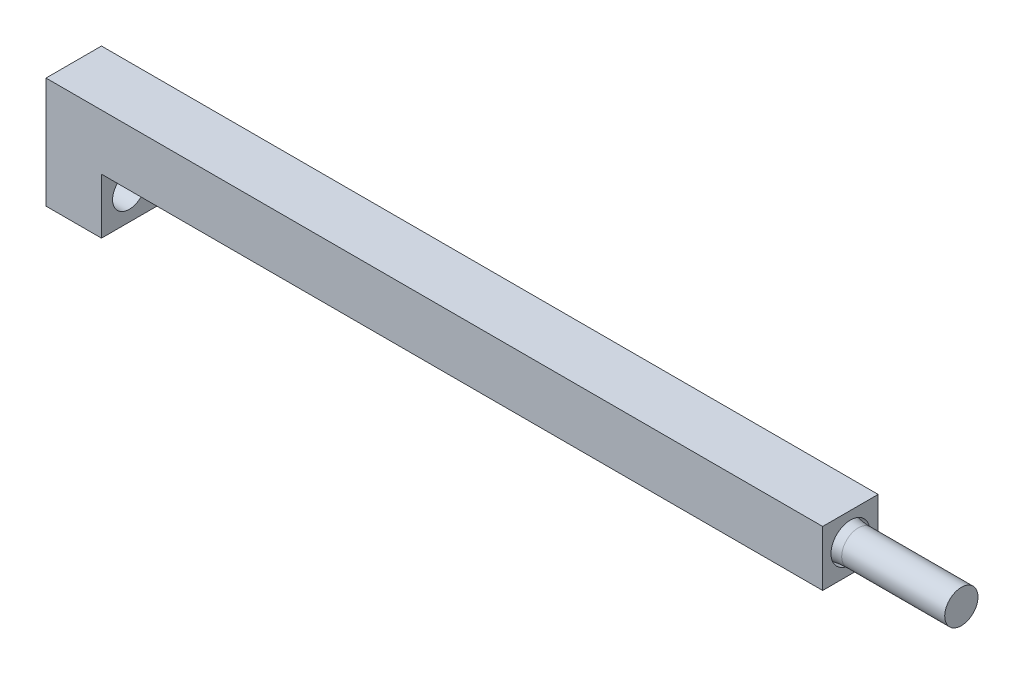
from build123d import *

# Parameters (mm, degrees)
BOSS_EXTRUDE1_DEPTH = 10
SKETCH4_R           = 3
CUT_EXTRUDE2_DEPTH  = 150
SKETCH4_5_R         = 3
BOSS_EXTRUDE3_DEPTH = 20
CUT_EXTRUDE4_START  = -2
SKETCH5_R           = 3.5
SKETCH5_R_2         = 3
CUT_EXTRUDE4_DEPTH  = 2
FILLET2_R           = 12


with BuildPart() as part:
    # Sketch1 → Boss-Extrude1 (new body)
    with BuildSketch(Plane.XY):
        Polygon((-140, 10), (0, 10), (0, 0), (-130, 0), (-130, -10), (-140, -10), align=None)
    extrude(amount=BOSS_EXTRUDE1_DEPTH)

    # Sketch4 → Cut-Extrude2 (cut)
    with BuildSketch(Plane(origin=(0, 0, 0), x_dir=(0, 0, -1), z_dir=(1, 0, 0))):
        with Locations(Location((-5, -5, 0), (0, 0, 90))):
            Circle(SKETCH4_R)
    extrude(amount=-CUT_EXTRUDE2_DEPTH, mode=Mode.SUBTRACT)

    # Sketch4<5> → Boss-Extrude3 (add)
    with BuildSketch(Plane(origin=(0, 0, 0), x_dir=(0, 0, -1), z_dir=(1, 0, 0))):
        with Locations((-5, 5)):
            Circle(SKETCH4_5_R)
    extrude(amount=BOSS_EXTRUDE3_DEPTH)

    # Sketch5 → Cut-Extrude4 (cut)
    with BuildSketch(Plane(origin=(0, 0, 0), x_dir=(0, 0, -1), z_dir=(1, 0, 0)).offset(CUT_EXTRUDE4_START)):
        with Locations(Location((-5, 5, 0), (0, 0, 90))):
            Circle(SKETCH5_R)
        with Locations(Location((-5, 5, 0), (0, 0, 90))):
            Circle(SKETCH5_R_2, mode=Mode.SUBTRACT)
    extrude(amount=CUT_EXTRUDE4_DEPTH, mode=Mode.SUBTRACT)

    # Fillet2
    # the kernel refuses this fillet: 12 mm, written as the material it adds along each edge
    with BuildSketch(Plane(origin=(-2, 5, 5), x_dir=(0, 1, 0), z_dir=(0, 0, -1))) as fillet2_piece_1:
        with BuildLine():
            CenterArc((15, 3.4278273), FILLET2_R, 180, 16.597842136)
            Line((3, 3.4278273), (2.76, 3.4278273))
            Line((2.76, 3.4278273), (2.76, 0))
            Line((2.76, 0), (3, -0.24))
            ThreePointArc((3, -0.24), (3.25, -0.24), (3.27, -0.068556546))
            Line((3.27, -0.068556546), (3.5, 0))
        make_face()
    revolve(axis=Axis((-2, 5, 5), (1, 0, 0)))


solid = part.part
